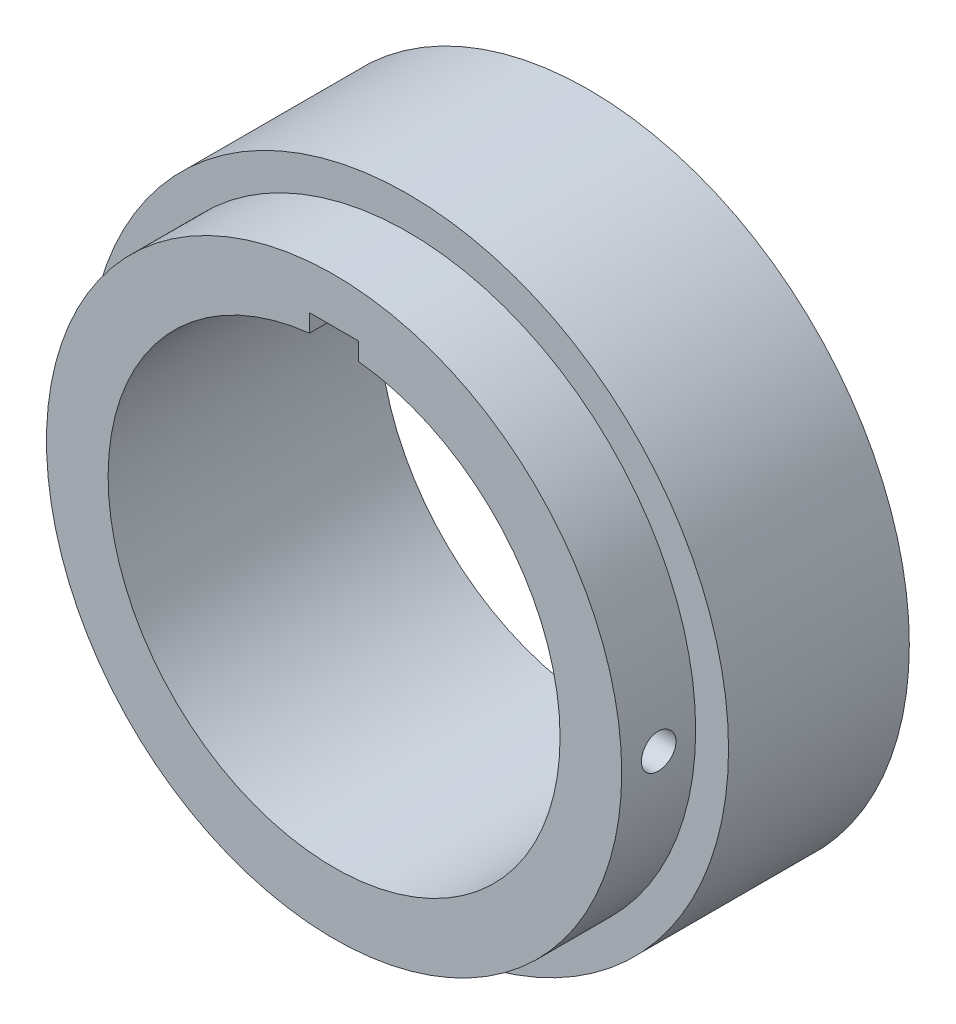
from build123d import *

# Parameters (mm, degrees)
SKETCH1_R             = 39
EXTRUDE1_DEPTH        = 22
SKETCH2_R             = 35
EXTRUDE2_DEPTH        = 9
SKETCH4_R             = 37.5
EXTRUDE4_DEPTH        = 2
EXTRUDE3_DEPTH        = 113
CHAMFER1_SIZE         = 2
M5_TAPPED_HOLE6_D     = 4.2
M5_TAPPED_HOLE6_DEPTH = 24
M5_TAPPED_HOLE6_TIP   = 1.2618073


with BuildPart() as part:
    # Sketch1 → Extrude1 (new body)
    with BuildSketch(Plane.XY):
        Circle(SKETCH1_R)
    extrude(amount=EXTRUDE1_DEPTH)

    # Sketch2 → Extrude2 (add)
    with BuildSketch(Plane.XY.offset(22)):
        Circle(SKETCH2_R)
    extrude(amount=EXTRUDE2_DEPTH)

    # Sketch4 → Extrude4 (add)
    with BuildSketch(Plane(origin=(0, 0, 0), x_dir=(-1, 0, 0), z_dir=(0, 0, -1))):
        with Locations(Location((0, 0, 0), (0, 0, 180))):
            Circle(SKETCH4_R)
    extrude(amount=EXTRUDE4_DEPTH)

    # Sketch3 → Extrude3 (cut)
    with BuildSketch(Plane.XY.offset(31)):
        with BuildLine():
            Line((-3, 29.5), (3, 29.5))
            Line((3, 29.5), (3, 27.335873866))
            ThreePointArc((3, 27.335873866), (0, -27.5), (-3, 27.335873866))
            Line((-3, 27.335873866), (-3, 29.5))
        make_face()
    extrude(amount=-EXTRUDE3_DEPTH, mode=Mode.SUBTRACT)

    # Chamfer1
    chamfer1_edges = [part.edges().sort_by_distance(p)[0] for p in [
        (-37.5, 0, -2),
    ]]
    chamfer(chamfer1_edges, length=CHAMFER1_SIZE - 0.0001)  # a hair under: the kernel refuses the full size

    # M5 Tapped Hole6
    with Locations(Plane(origin=(35, 0, 26.5), x_dir=(0, 1, 0), z_dir=(1, 0, 0))):
        with Locations((0, 0)):
            Hole(M5_TAPPED_HOLE6_D / 2, depth=M5_TAPPED_HOLE6_DEPTH)
            with Locations((0, 0, -(M5_TAPPED_HOLE6_DEPTH + M5_TAPPED_HOLE6_TIP / 2))):  # 118° drill point
                Cone(0, M5_TAPPED_HOLE6_D / 2, M5_TAPPED_HOLE6_TIP, mode=Mode.SUBTRACT)


solid = part.part
